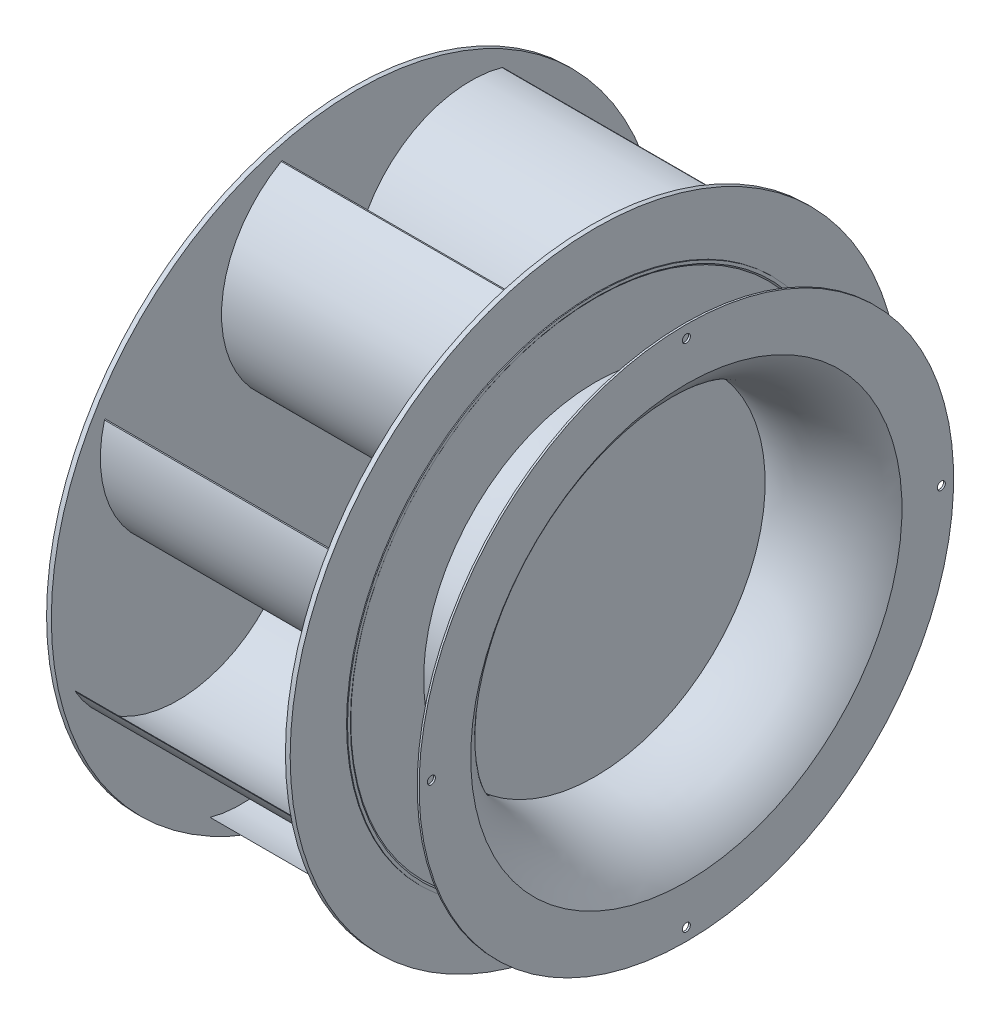
from build123d import *
from build123d.topology import SkipClean

# Parameters (mm, degrees)
SKETCH2_R         = 322
EXTRUDE1_DEPTH    = 5
SKETCH9_R         = 317
SKETCH9_R_2       = 100
EXTRUDE7_DEPTH    = 3
SKETCH3_R         = 322
EXTRUDE2_DEPTH    = 5
EXTRUDE3_DEPTH    = 252
CIRPATTERN1_COUNT = 8
SKETCH7_R         = 4.25
EXTRUDE5_DEPTH    = 5
CIRPATTERN2_COUNT = 4
SKETCH8_R         = 5
EXTRUDE6_DEPTH    = 90
CIRPATTERN3_COUNT = 8


with BuildPart() as part:
    # Sketch1 → Revolve1 (revolve)
    with BuildSketch(Plane.XY, mode=Mode.PRIVATE) as revolve1_sk:
        with BuildLine():
            Line((0, 0), (0, 109))
            ThreePointArc((0, 109), (1.464466094, 112.535533906), (5, 114))
            Line((5, 114), (70, 114))
            Line((70, 114), (70, 138))
            Line((70, 138), (90, 138))
            Line((90, 138), (90, 98))
            Line((90, 98), (95, 98))
            Line((95, 98), (95, 133))
            Line((95, 133), (105, 133))
            Line((105, 133), (105, 98))
            Line((105, 98), (129, 98))
            Line((129, 98), (129, 0))
            Line((129, 0), (0, 0))
        make_face()
    revolve(revolve1_sk.sketch.rotate(Axis((0, 0, 0), (1, 0, 0)), 90), axis=Axis((0, 0, 0), (1, 0, 0)))

    # Sketch2 → Extrude1 (add)
    with BuildSketch(Plane(origin=(129, 0, 0), x_dir=(0, 0, -1), z_dir=(1, 0, 0))):
        Circle(SKETCH2_R)
    extrude(amount=EXTRUDE1_DEPTH)

    # Sketch9 → Extrude7 (cut)
    with BuildSketch(Plane.ZY.offset(-129)):
        Circle(SKETCH9_R)
        Circle(SKETCH9_R_2, mode=Mode.SUBTRACT)
    extrude(amount=-EXTRUDE7_DEPTH, mode=Mode.SUBTRACT)



with BuildPart() as body_2:
    # Sketch3 → Extrude2 (new body)
    with BuildSketch(Plane(origin=(381, 0, 0), x_dir=(0, 0, -1), z_dir=(1, 0, 0))):
        Circle(SKETCH3_R)
    extrude(amount=EXTRUDE2_DEPTH)


with BuildPart() as part_1:
    add(part.part)

    add(body_2.part)  # Extrude3 merges body 2
    # Sketch4 → Extrude3 (add)
    with BuildSketch(Plane(origin=(134, 0, 0), x_dir=(0, 0, -1), z_dir=(1, 0, 0))):
        with BuildLine():
            Line((0, 112.5), (0.866025404, 112))
            ThreePointArc((0.866025404, 112), (33.143390798, 233.195288477), (154.366025404, 265.369798962))
            Line((154.366025404, 265.369798962), (153.5, 265.869798962))
            ThreePointArc((153.5, 265.869798962), (32.277365394, 233.695288477), (0, 112.5))
        make_face()
    extrude3 = extrude(amount=EXTRUDE3_DEPTH)

    # CirPattern1: Extrude3 ×8 about axis
    cirpattern1_axis = Axis((0, 0, 0), (1, 0, 0))
    for i in range(1, CIRPATTERN1_COUNT):
        add(extrude3.rotate(cirpattern1_axis, i * 360 / CIRPATTERN1_COUNT))

    # Sketch5 → Revolve2 (revolve)
    with SkipClean():  # the faces are left unmerged after this step: merging them gives an invalid solid
        with BuildSketch(Plane.XY, mode=Mode.PRIVATE) as revolve2_sk:
            with BuildLine():
                Line((386, 262.5), (387, 262.5))
                Line((387, 262.5), (387, 259.5))
                ThreePointArc((387, 259.5), (373.951041336, 221.449959428), (384, 182.5))
                Line((384, 182.5), (384, 181.5))
                ThreePointArc((384, 181.5), (373.124467562, 220.804500832), (386, 259.5))
                Line((386, 259.5), (386, 262.5))
            make_face()
        revolve(revolve2_sk.sketch.rotate(Axis((0, 0, 0), (1, 0, 0)), 90), axis=Axis((0, 0, 0), (1, 0, 0)))

    # Sketch8 → Extrude6 (cut)
    with SkipClean():  # the faces are left unmerged after this step: merging them gives an invalid solid
        with BuildSketch(Plane(origin=(0, 0, 0), x_dir=(0, 0, -1), z_dir=(1, 0, 0))):
            with Locations(Location((0, 126, 0), (0, 0, 180))):
                Circle(SKETCH8_R)
        extrude6 = extrude(amount=EXTRUDE6_DEPTH, mode=Mode.SUBTRACT)

    # CirPattern3: Extrude6 ×8 about axis
    with SkipClean():  # the faces are left unmerged after this step: merging them gives an invalid solid
        cirpattern3_axis = Axis((0, 0, 0), (1, 0, 0))
        for i in range(1, CIRPATTERN3_COUNT):
            add(extrude6.rotate(cirpattern3_axis, i * 360 / CIRPATTERN3_COUNT), mode=Mode.SUBTRACT)


with BuildPart() as body_2_2:
    # Sketch6 → Revolve3 (revolve)
    with BuildSketch(Plane.XY, mode=Mode.PRIVATE) as revolve3_sk:
        with BuildLine():
            Line((482, 282), (480, 282))
            Line((480, 282), (480, 227.5))
            ThreePointArc((480, 227.5), (437.763122811, 190.091607925), (382, 181.5))
            Line((382, 181.5), (378, 181.5))
            Line((378, 181.5), (378, 179.5))
            Line((378, 179.5), (382, 179.5))
            ThreePointArc((382, 179.5), (439.265305263, 188.363947369), (482, 227.5))
            Line((482, 227.5), (482, 282))
        make_face()
    revolve(revolve3_sk.sketch.rotate(Axis((0, 0, 0), (1, 0, 0)), 180), axis=Axis((0, 0, 0), (1, 0, 0)))

    # Sketch7 → Extrude5 (cut)
    with BuildSketch(Plane(origin=(482, 0, 0), x_dir=(0, 0, -1), z_dir=(1, 0, 0))):
        with Locations((0, 269)):
            Circle(SKETCH7_R)
    extrude5 = extrude(amount=-EXTRUDE5_DEPTH, mode=Mode.SUBTRACT)

    # CirPattern2: Extrude5 ×4 about axis
    cirpattern2_axis = Axis((0, 0, 0), (1, 0, 0))
    for i in range(1, CIRPATTERN2_COUNT):
        add(extrude5.rotate(cirpattern2_axis, i * 360 / CIRPATTERN2_COUNT), mode=Mode.SUBTRACT)


solid = Compound([part_1.part, body_2_2.part])
